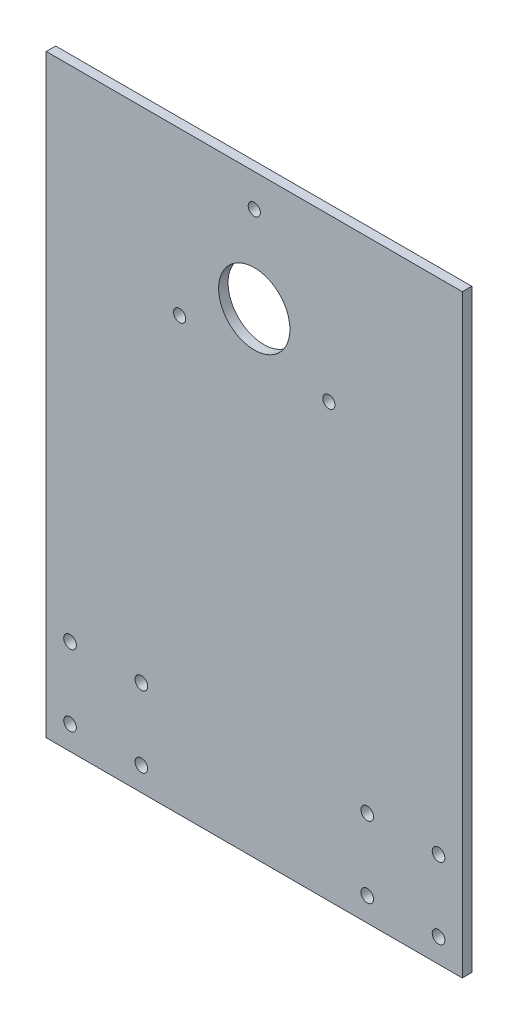
from build123d import *

# Parameters (mm, degrees)
SKETCH1_W           = 140
SKETCH1_H           = 200
SKETCH1_R           = 2.05
SKETCH1_R_2         = 12
SKETCH1_R_3         = 2.125
BOSS_EXTRUDE1_DEPTH = 3.175


with BuildPart() as part:
    # Sketch1 → Boss-Extrude1 (new body)
    with BuildSketch(Plane.XY):
        Rectangle(SKETCH1_W, SKETCH1_H)
        with Locations((0, 89)):
            Circle(SKETCH1_R, mode=Mode.SUBTRACT)
        with Locations((25.11473671, 45.5)):
            Circle(SKETCH1_R, mode=Mode.SUBTRACT)
        with Locations((-25.11473671, 45.5)):
            Circle(SKETCH1_R, mode=Mode.SUBTRACT)
        with Locations((0, 60)):
            Circle(SKETCH1_R_2, mode=Mode.SUBTRACT)
        with Locations((-62, -92)):
            Circle(SKETCH1_R_3, mode=Mode.SUBTRACT)
        with Locations((-38, -92)):
            Circle(SKETCH1_R_3, mode=Mode.SUBTRACT)
        with Locations((-38, -68)):
            Circle(SKETCH1_R_3, mode=Mode.SUBTRACT)
        with Locations((-62, -68)):
            Circle(SKETCH1_R_3, mode=Mode.SUBTRACT)
        with Locations((38, -92)):
            Circle(SKETCH1_R_3, mode=Mode.SUBTRACT)
        with Locations((62, -92)):
            Circle(SKETCH1_R_3, mode=Mode.SUBTRACT)
        with Locations((62, -68)):
            Circle(SKETCH1_R_3, mode=Mode.SUBTRACT)
        with Locations((38, -68)):
            Circle(SKETCH1_R_3, mode=Mode.SUBTRACT)
    extrude(amount=BOSS_EXTRUDE1_DEPTH)


solid = part.part
